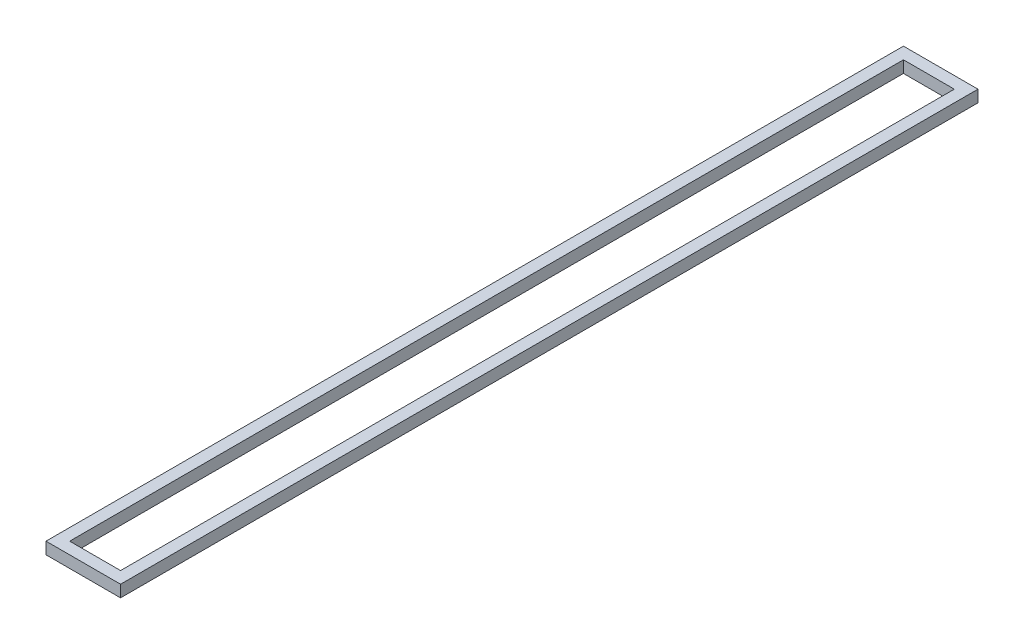
from build123d import *

# Parameters (mm, degrees)
SKETCH1_W           = 100
SKETCH1_H           = 1150
SKETCH1_W_2         = 68.25
SKETCH1_H_2         = 1118.25
BOSS_EXTRUDE1_DEPTH = 15.875


with BuildPart() as part:
    # Sketch1 → Boss-Extrude1 (new body)
    with BuildSketch(Plane(origin=(0, 0, 0), x_dir=(1, 0, 0), z_dir=(0, 1, 0))):
        Rectangle(SKETCH1_W, SKETCH1_H)
        Rectangle(SKETCH1_W_2, SKETCH1_H_2, mode=Mode.SUBTRACT)
    extrude(amount=BOSS_EXTRUDE1_DEPTH)


solid = part.part
